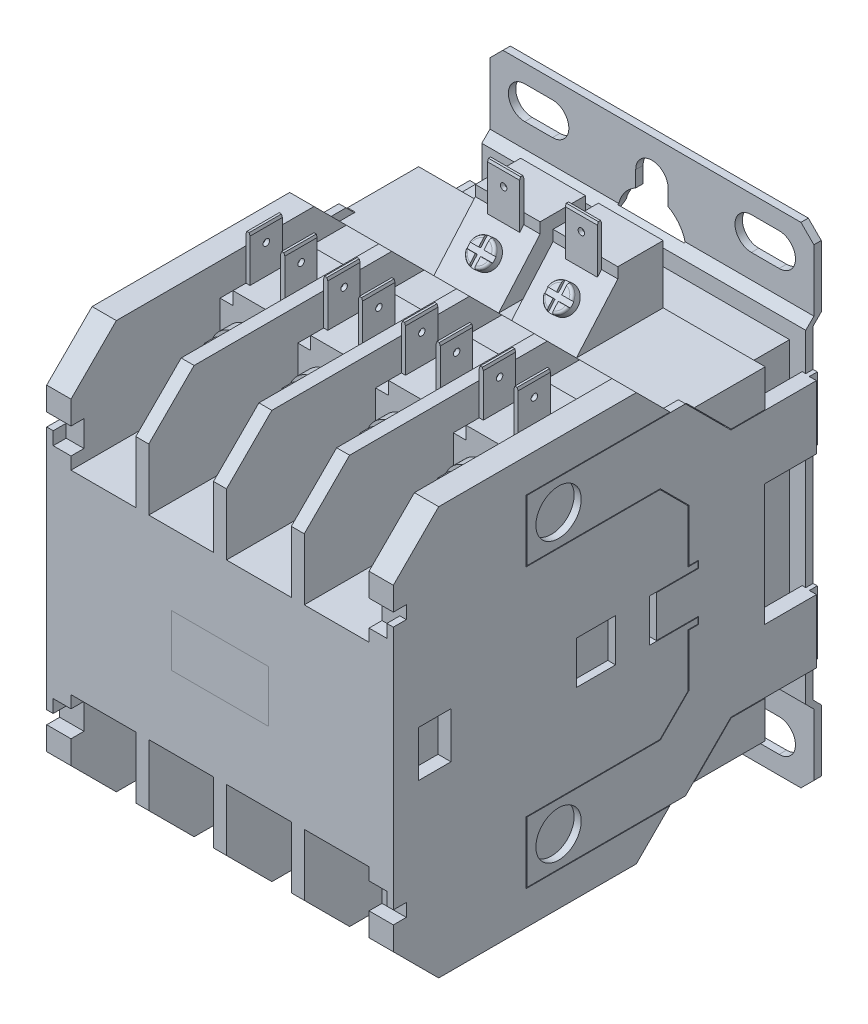
from build123d import *
from OCP.BRepFilletAPI import BRepFilletAPI_MakeChamfer

# Parameters (mm, degrees)
BOSS_EXTRUDE1_DEPTH      = 33.9725
BOSS_EXTRUDE1_DEPTH_BACK = 33.9725
BOSS_EXTRUDE2_DEPTH      = 31.75
BOSS_EXTRUDE2_DEPTH_BACK = 31.75
CUT_EXTRUDE1_DEPTH       = 105.273438748
CHAMFER1_SIZE            = 2.54
SKETCH7_W                = 12.7
SKETCH7_H                = 20.955
CUT_EXTRUDE2_DEPTH       = 31.75
SKETCH8_W                = 12.7
SKETCH8_H                = 6.35
CUT_EXTRUDE3_DEPTH       = 105.273438748
CUT_EXTRUDE5_DEPTH       = 103.95599558
BOSS_EXTRUDE3_START      = 4.191
BOSS_EXTRUDE3_DEPTH      = 2.54
SKETCH14_W               = 7.62
SKETCH14_H               = 2.54
BOSS_EXTRUDE4_DEPTH      = 12.7
SKETCH15_W               = 0.8
SKETCH15_H               = 6.35
BOSS_EXTRUDE5_DEPTH      = 8.89
SKETCH16_R               = 5.715
BOSS_EXTRUDE6_DEPTH      = 2.54
BOSS_EXTRUDE7_DEPTH      = 2.54
SKETCH30_R               = 0.635
CUT_EXTRUDE11_DEPTH      = 93.187938838
SKETCH18_OUTSIDE_W       = 398.532
SKETCH18_OUTSIDE_H       = 426.598
SKETCH18_OUTSIDE_R       = 4.7625
CUT_EXTRUDE6_DEPTH       = 86.43846539
CUT_EXTRUDE6_DRAFT       = -60
SKETCH19_W               = 1.016
SKETCH19_H               = 5.715
SKETCH19_W_2             = 9.525
SKETCH19_H_2             = 1.016
CUT_EXTRUDE_THIN1_DEPTH  = 1.27
CHAMFER2_SIZE            = 0.508
CHAMFER2_SIZE2           = 0.184896879
LPATTERN1_COUNT          = 2
LPATTERN1_PITCH          = 15.24
CUT_EXTRUDE7_DEPTH       = 2.54
SKETCH21_W               = 10.16
SKETCH21_H               = 57.15
CUT_EXTRUDE8_DEPTH       = 5.3975
CUT_EXTRUDE9_DEPTH       = 1.524
BOSS_EXTRUDE8_DEPTH      = 1.397
SKETCH24_W               = 11.4808
SKETCH24_H               = 12.446
BOSS_EXTRUDE9_DEPTH      = 1.524
SKETCH25_R               = 4.445
CUT_EXTRUDE10_DEPTH      = 97.087733359
BOSS_EXTRUDE10_START     = 1.27
BOSS_EXTRUDE10_DEPTH     = 12.7
BOSS_EXTRUDE11_START     = -1.27
BOSS_EXTRUDE11_DEPTH     = 12.7
SKETCH27_R               = 2.54
BOSS_EXTRUDE12_DEPTH     = 1.905
FILLET2_R                = 0.508
SKETCH28_W               = 6.3
SKETCH28_H               = 0.8
BOSS_EXTRUDE13_DEPTH     = 17.78
CHAMFER3_SIZE            = 0.508
CHAMFER3_SIZE2           = 0.184896879
SKETCH29_W               = 1.016
SKETCH29_H               = 5.08
SKETCH29_W_2             = 5.08
SKETCH29_H_2             = 1.016
CUT_EXTRUDE_THIN2_DEPTH  = 0.508
SKETCH31_R               = 0.635
CUT_EXTRUDE12_DEPTH      = 88.192906364
SKETCH32_W               = 15.494
SKETCH32_H               = 8.382
CUT_EXTRUDE13_DEPTH      = 1.524
SKETCH33_W               = 6.604
SKETCH33_H               = 8.382
BOSS_EXTRUDE14_DEPTH     = 1.524
SKETCH34_W               = 6.35
SKETCH34_H               = 9.017
CUT_EXTRUDE14_DEPTH      = 2.54


with BuildPart() as part:
    # Sketch4 → Boss-Extrude1 (new, two sides: drawn at the far end of the back side and taken through both)
    with BuildSketch(Plane(origin=(0, 0, 0), x_dir=(0, 0, -1), z_dir=(1, 0, 0)).offset(-BOSS_EXTRUDE1_DEPTH_BACK)):
        Polygon((-35.941, -31.115), (-35.941, 31.115), (-27.051, 40.005), (11.684, 40.005), (19.939, 31.75), (36.957, 31.75), (36.957, 28.575), (47.117, 28.575), (47.117, -28.575), (36.957, -28.575), (36.957, -31.75), (19.939, -31.75), (11.684, -40.005), (-27.051, -40.005), align=None)
    extrude(amount=BOSS_EXTRUDE1_DEPTH + BOSS_EXTRUDE1_DEPTH_BACK)

    # Sketch7 → Cut-Extrude2 (cut)
    with BuildSketch(Plane.XY.offset(35.941)):
        with Locations((-7.62, 29.5275)):
            Rectangle(SKETCH7_W, SKETCH7_H)
        with Locations((-22.86, 29.5275)):
            Rectangle(SKETCH7_W, SKETCH7_H)
        with Locations((7.62, 29.5275)):
            Rectangle(SKETCH7_W, SKETCH7_H)
        with Locations((22.86, 29.5275)):
            Rectangle(SKETCH7_W, SKETCH7_H)
        with Locations((7.62, -29.5275)):
            Rectangle(SKETCH7_W, SKETCH7_H)
        with Locations((22.86, -29.5275)):
            Rectangle(SKETCH7_W, SKETCH7_H)
        with Locations((-7.62, -29.5275)):
            Rectangle(SKETCH7_W, SKETCH7_H)
        with Locations((-22.86, -29.5275)):
            Rectangle(SKETCH7_W, SKETCH7_H)
    extrude(amount=-CUT_EXTRUDE2_DEPTH, mode=Mode.SUBTRACT)

    # Sketch8 → Cut-Extrude3 (cut, through all)
    with BuildSketch(Plane.XY.offset(35.941)):
        with Locations((-22.86, 36.83)):
            Rectangle(SKETCH8_W, SKETCH8_H)
        with Locations((-7.62, 36.83)):
            Rectangle(SKETCH8_W, SKETCH8_H)
        with Locations((7.62, 36.83)):
            Rectangle(SKETCH8_W, SKETCH8_H)
        with Locations((22.86, 36.83)):
            Rectangle(SKETCH8_W, SKETCH8_H)
        with Locations((22.86, -36.83)):
            Rectangle(SKETCH8_W, SKETCH8_H)
        with Locations((7.62, -36.83)):
            Rectangle(SKETCH8_W, SKETCH8_H)
        with Locations((-7.62, -36.83)):
            Rectangle(SKETCH8_W, SKETCH8_H)
        with Locations((-22.86, -36.83)):
            Rectangle(SKETCH8_W, SKETCH8_H)
    extrude(amount=-CUT_EXTRUDE3_DEPTH, mode=Mode.SUBTRACT)

    # Sketch20 → Cut-Extrude7 (cut)
    with BuildSketch(Plane.XY.offset(35.941)):
        Polygon((-29.21, 21.463), (-32.7025, 21.463), (-32.7025, 24.003), (-33.9725, 24.003), (-33.9725, 26.543), (-29.21, 26.543), align=None)
        Polygon((29.21, 26.543), (29.21, 21.463), (32.7025, 21.463), (32.7025, 24.003), (33.9725, 24.003), (33.9725, 26.543), align=None)
        Polygon((-29.21, -26.543), (-29.21, -21.463), (-32.7025, -21.463), (-32.7025, -24.003), (-33.9725, -24.003), (-33.9725, -26.543), align=None)
        Polygon((29.21, -21.463), (32.7025, -21.463), (32.7025, -24.003), (33.9725, -24.003), (33.9725, -26.543), (29.21, -26.543), align=None)
    extrude(amount=-CUT_EXTRUDE7_DEPTH, mode=Mode.SUBTRACT)

    # Sketch21 → Cut-Extrude8 (cut)
    with BuildSketch(Plane(origin=(33.9725, 0, 0), x_dir=(0, 0, -1), z_dir=(1, 0, 0))):
        with Locations((42.037, 0)):
            Rectangle(SKETCH21_W, SKETCH21_H)
    cut_extrude8 = extrude(amount=-CUT_EXTRUDE8_DEPTH, mode=Mode.SUBTRACT)

    # Mirror3: Cut-Extrude8 across plane
    add(cut_extrude8.mirror(Plane(origin=(0, 0, 0), x_dir=(0, 0, 1), z_dir=(1, 0, 0))), mode=Mode.SUBTRACT)

    # Sketch22 → Cut-Extrude9 (cut)
    with BuildSketch(Plane(origin=(33.9725, 0, 0), x_dir=(0, 0, -1), z_dir=(1, 0, 0))):
        Polygon((15.494, 4.191), (15.494, -4.191), (23.749, -4.191), (23.749, -5.334), (21.844, -5.334), (21.844, -15.69559278), (16.33059278, -21.209), (-9.906, -21.209), (-9.906, -33.401), (21.380684533, -33.401), (30.270684533, -24.511), (47.117, -24.511), (47.117, -11.811), (36.957, -11.811), (36.957, 11.811), (47.117, 11.811), (47.117, 24.511), (30.270684533, 24.511), (21.380684533, 33.401), (-9.906, 33.401), (-9.906, 21.209), (16.33059278, 21.209), (21.844, 15.69559278), (21.844, 5.334), (23.749, 5.334), (23.749, 4.191), align=None)
    cut_extrude9 = extrude(amount=-CUT_EXTRUDE9_DEPTH, mode=Mode.SUBTRACT)

    # Mirror4: Cut-Extrude9 across plane
    add(cut_extrude9.mirror(Plane(origin=(0, 0, 0), x_dir=(0, 0, 1), z_dir=(1, 0, 0))), mode=Mode.SUBTRACT)

    # Sketch26 → Boss-Extrude10 (add)
    with BuildSketch(Plane(origin=(0, 0, 0), x_dir=(0, 0, -1), z_dir=(1, 0, 0)).offset(BOSS_EXTRUDE10_START)):
        Polygon((19.939, 31.75), (36.957, 31.75), (36.957, 43.18), (28.067, 43.18), (28.067, 41.100194414), align=None)
    extrude(amount=BOSS_EXTRUDE10_DEPTH)

    # Sketch26<2> → Boss-Extrude11 (add)
    with BuildSketch(Plane(origin=(0, 0, 0), x_dir=(0, 0, -1), z_dir=(1, 0, 0)).offset(BOSS_EXTRUDE11_START)):
        Polygon((19.939, 31.75), (36.957, 31.75), (36.957, 43.18), (28.067, 43.18), (28.067, 41.100194414), align=None)
    extrude(amount=-BOSS_EXTRUDE11_DEPTH)

    # Sketch32 → Cut-Extrude13 (cut)
    with BuildSketch(Plane(origin=(33.9725, 0, 0), x_dir=(0, 0, -1), z_dir=(1, 0, 0))):
        with Locations((7.747, 0)):
            Rectangle(SKETCH32_W, SKETCH32_H)
    cut_extrude13 = extrude(amount=-CUT_EXTRUDE13_DEPTH, mode=Mode.SUBTRACT)

    # Sketch33 → Boss-Extrude14 (add)
    with BuildSketch(Plane(origin=(32.4485, 0, 0), x_dir=(0, 0, -1), z_dir=(1, 0, 0))):
        with Locations((10.922, 0)):
            Rectangle(SKETCH33_W, SKETCH33_H)
    boss_extrude14 = extrude(amount=BOSS_EXTRUDE14_DEPTH)

    # Sketch34 → Cut-Extrude14 (cut)
    with BuildSketch(Plane(origin=(33.9725, 0, 0), x_dir=(0, 0, -1), z_dir=(1, 0, 0))):
        with Locations((-27.813, 0)):
            Rectangle(SKETCH34_W, SKETCH34_H)
    cut_extrude14 = extrude(amount=-CUT_EXTRUDE14_DEPTH, mode=Mode.SUBTRACT)

    # Mirror11: Cut-Extrude13, Boss-Extrude14, Cut-Extrude14 across plane
    add(cut_extrude13.mirror(Plane(origin=(0, 0, 0), x_dir=(0, 0, 1), z_dir=(1, 0, 0))), mode=Mode.SUBTRACT)
    add(boss_extrude14.mirror(Plane(origin=(0, 0, 0), x_dir=(0, 0, 1), z_dir=(1, 0, 0))))
    add(cut_extrude14.mirror(Plane(origin=(0, 0, 0), x_dir=(0, 0, 1), z_dir=(1, 0, 0))), mode=Mode.SUBTRACT)


with BuildPart() as body_2:
    # Sketch5 → Boss-Extrude2 (new, two sides: drawn at the far end of the back side and taken through both)
    with BuildSketch(Plane(origin=(0, 0, 0), x_dir=(0, 0, -1), z_dir=(1, 0, 0)).offset(-BOSS_EXTRUDE2_DEPTH_BACK)):
        Polygon((48.5648, -31.749594041), (48.5648, 31.749594041), (50.165, 33.349794041), (50.165, 48.006), (48.7172, 48.006), (48.7172, 33.349794041), (47.117, 31.749594041), (47.117, -31.749594041), (48.7172, -33.349794041), (48.7172, -48.006), (50.165, -48.006), (50.165, -33.349794041), align=None)
    extrude(amount=BOSS_EXTRUDE2_DEPTH + BOSS_EXTRUDE2_DEPTH_BACK)

    # Sketch6 → Cut-Extrude1 (cut, through all)
    with BuildSketch(Plane(origin=(0, 0, -50.165), x_dir=(-1, 0, 0), z_dir=(0, 0, -1))):
        with BuildLine():
            Line((-24.931440805, 38.0390146), (-19.490995499, 38.0390146))
            ThreePointArc((-19.490995499, 38.0390146), (-16.285490099, 41.24452), (-19.490995499, 44.4500254))
            Line((-19.490995499, 44.4500254), (-24.931440805, 44.4500254))
            ThreePointArc((-24.931440805, 44.4500254), (-28.136946205, 41.24452), (-24.931440805, 38.0390146))
        make_face()
        with BuildLine():
            Line((19.490995499, 44.4500254), (24.931440805, 44.4500254))
            ThreePointArc((24.931440805, 44.4500254), (28.136946205, 41.24452), (24.931440805, 38.0390146))
            Line((24.931440805, 38.0390146), (19.490995499, 38.0390146))
            ThreePointArc((19.490995499, 38.0390146), (16.285490099, 41.24452), (19.490995499, 44.4500254))
        make_face()
        with BuildLine():
            Line((24.931440805, -38.0390146), (19.490995499, -38.0390146))
            ThreePointArc((19.490995499, -38.0390146), (16.285490099, -41.24452), (19.490995499, -44.4500254))
            Line((19.490995499, -44.4500254), (24.931440805, -44.4500254))
            ThreePointArc((24.931440805, -44.4500254), (28.136946205, -41.24452), (24.931440805, -38.0390146))
        make_face()
        with BuildLine():
            Line((-19.490995499, -44.4500254), (-24.931440805, -44.4500254))
            ThreePointArc((-24.931440805, -44.4500254), (-28.136946205, -41.24452), (-24.931440805, -38.0390146))
            Line((-24.931440805, -38.0390146), (-19.490995499, -38.0390146))
            ThreePointArc((-19.490995499, -38.0390146), (-16.285490099, -41.24452), (-19.490995499, -44.4500254))
        make_face()
    extrude(amount=-CUT_EXTRUDE1_DEPTH, mode=Mode.SUBTRACT)

    # Chamfer1
    chamfer1_edges = [body_2.edges().sort_by_distance(p)[0] for p in [
        (31.75, 48.006, -49.4411),
        (31.75, -48.006, -49.4411),
        (-31.75, -48.006, -49.4411),
        (-31.75, 48.006, -49.4411),
    ]]
    chamfer(chamfer1_edges, length=CHAMFER1_SIZE)

    # Sketch10 → Cut-Extrude5 (cut, through all)
    with BuildSketch(Plane(origin=(0, 0, -48.5648), x_dir=(-1, 0, 0), z_dir=(0, 0, -1))):
        with BuildLine():
            Line((-7.62, -48.006), (-11.43, -48.006))
            Line((-11.43, -48.006), (-11.43, -35.4838))
            ThreePointArc((-11.43, -35.4838), (-9.525, -33.5788), (-7.62, -35.4838))
            Line((-7.62, -35.4838), (-7.62, -48.006))
        make_face()
        with BuildLine():
            Line((-3.81, -48.006), (3.81, -48.006))
            Line((3.81, -48.006), (3.81, -37.3888))
            ThreePointArc((3.81, -37.3888), (0, -33.5788), (-3.81, -37.3888))
            Line((-3.81, -37.3888), (-3.81, -48.006))
        make_face()
        with BuildLine():
            Line((7.62, -48.006), (11.43, -48.006))
            Line((11.43, -48.006), (11.43, -35.4838))
            ThreePointArc((11.43, -35.4838), (9.525, -33.5788), (7.62, -35.4838))
            Line((7.62, -35.4838), (7.62, -48.006))
        make_face()
        with BuildLine():
            Line((-6.697512638, 31.749594041), (6.697512638, 31.749594041))
            ThreePointArc((6.697512638, 31.749594041), (5.749838178, 35.184129884), (3.175, 37.646716266))
            Line((3.175, 37.646716266), (3.175, 40.767))
            ThreePointArc((3.175, 40.767), (0, 43.942), (-3.175, 40.767))
            Line((-3.175, 40.767), (-3.175, 37.646716266))
            ThreePointArc((-3.175, 37.646716266), (-5.749838178, 35.184129884), (-6.697512638, 31.749594041))
        make_face()
    extrude(amount=CUT_EXTRUDE5_DEPTH, mode=Mode.SUBTRACT)


with BuildPart() as body_3:
    # Sketch12 → Boss-Extrude3 (new body)
    with BuildSketch(Plane.XY.offset(BOSS_EXTRUDE3_START)):
        Polygon((-16.51, 19.05), (-16.51, 33.655), (-19.05, 33.655), (-19.05, 36.195), (-26.67, 36.195), (-26.67, 33.655), (-29.21, 33.655), (-29.21, 19.05), align=None)
    extrude(amount=BOSS_EXTRUDE3_DEPTH)

    # Sketch14 → Boss-Extrude4 (add)
    with BuildSketch(Plane(origin=(0, 0, 4.191), x_dir=(-1, 0, 0), z_dir=(0, 0, -1))):
        with Locations((22.86, 34.925)):
            Rectangle(SKETCH14_W, SKETCH14_H)
    extrude(amount=BOSS_EXTRUDE4_DEPTH)

    # Sketch15 → Boss-Extrude5 (add)
    with BuildSketch(Plane(origin=(0, 36.195, 0), x_dir=(1, 0, 0), z_dir=(0, 1, 0))):
        with Locations((-26.27, -1.016)):
            Rectangle(SKETCH15_W, SKETCH15_H)
        with Locations((-19.45, -1.016)):
            Rectangle(SKETCH15_W, SKETCH15_H)
    extrude(amount=BOSS_EXTRUDE5_DEPTH)

    # Sketch30 → Cut-Extrude11 (cut, through all)
    with BuildSketch(Plane.ZY.offset(26.67)):
        with Locations((0.991, 41.91)):
            Circle(SKETCH30_R)
    extrude(amount=-CUT_EXTRUDE11_DEPTH, mode=Mode.SUBTRACT)

    # Chamfer2: one chamfer whose edges measure the first distance from different faces: ONE call of the kernel's chamfer builder (chamfer() names one face for all edges)
    chamfer2_edges_1 = [body_3.edges().sort_by_distance(p)[0] for p in [
        (-19.05, 45.085, 1.016),
    ]]
    chamfer2_side_1 = [body_3.faces().sort_by_distance(p)[0] for p in [
        (-19.05, 38.26675598, 0.230967317),
    ]]
    chamfer2_edges_2 = [body_3.edges().sort_by_distance(p)[0] for p in [
        (-19.85, 45.085, 1.016),
    ]]
    chamfer2_side_2 = [body_3.faces().sort_by_distance(p)[0] for p in [
        (-19.85, 40.610847077, 1.016573876),
    ]]
    chamfer2_edges_3 = [body_3.edges().sort_by_distance(p)[0] for p in [
        (-25.87, 45.085, 1.016),
    ]]
    chamfer2_side_3 = [body_3.faces().sort_by_distance(p)[0] for p in [
        (-25.87, 40.610847077, 1.016573876),
    ]]
    chamfer2_edges_4 = [body_3.edges().sort_by_distance(p)[0] for p in [
        (-26.67, 45.085, 1.016),
    ]]
    chamfer2_side_4 = [body_3.faces().sort_by_distance(p)[0] for p in [
        (-26.67, 38.26675598, 0.230967317),
    ]]
    chamfer2 = BRepFilletAPI_MakeChamfer(body_3.part.solid().wrapped)
    for e in chamfer2_edges_1:
        chamfer2.Add(CHAMFER2_SIZE, CHAMFER2_SIZE2, e.wrapped, chamfer2_side_1[0].wrapped)  # the first distance lies on this face
    for e in chamfer2_edges_2:
        chamfer2.Add(CHAMFER2_SIZE, CHAMFER2_SIZE2, e.wrapped, chamfer2_side_2[0].wrapped)  # the first distance lies on this face
    for e in chamfer2_edges_3:
        chamfer2.Add(CHAMFER2_SIZE, CHAMFER2_SIZE2, e.wrapped, chamfer2_side_3[0].wrapped)  # the first distance lies on this face
    for e in chamfer2_edges_4:
        chamfer2.Add(CHAMFER2_SIZE, CHAMFER2_SIZE2, e.wrapped, chamfer2_side_4[0].wrapped)  # the first distance lies on this face
    add(Compound.cast(chamfer2.Shape()), mode=Mode.REPLACE)


with BuildPart() as body_4:
    # Sketch16 → Boss-Extrude6 (new body)
    with BuildSketch(Plane.XY.offset(6.731)):
        with Locations((-22.86, 26.3525)):
            Circle(SKETCH16_R)
    extrude(amount=BOSS_EXTRUDE6_DEPTH)

    # Sketch17 → Boss-Extrude7 (add)
    with BuildSketch(Plane.XY.offset(9.271)):
        Polygon((-22.86, 31.851761314), (-27.6225, 29.102130657), (-27.6225, 23.602869343), (-22.86, 20.853238686), (-18.0975, 23.602869343), (-18.0975, 29.102130657), align=None)
    extrude(amount=BOSS_EXTRUDE7_DEPTH)


with BuildPart() as cut_extrude6_tool:
    # Sketch18 outside → Cut-Extrude6 (with draft: the straight prism first)
    with BuildSketch(Plane.XY.offset(11.811)):
        Rectangle(SKETCH18_OUTSIDE_W, SKETCH18_OUTSIDE_H)
        with Locations((-22.86, 26.3525)):
            Circle(SKETCH18_OUTSIDE_R, mode=Mode.SUBTRACT)
    extrude(amount=-CUT_EXTRUDE6_DEPTH)
    # Cut-Extrude6: the draft: its side faces are tilted about the plane it starts from
    cut_extrude6_sides = [cut_extrude6_tool.faces().sort_by_distance(p)[0] for p in [
        (0, -213.299, -31.408232695),
        (199.266, 0, -31.408232695),
        (0, 213.299, -31.408232695),
        (-199.266, 0, -31.408232695),
        (-27.6225, 26.3525, -31.408232695),
    ]]
    draft(cut_extrude6_sides, Plane.XY.offset(11.811), CUT_EXTRUDE6_DRAFT)


with BuildPart() as body_4_1:
    add(body_4.part)

    # Cut-Extrude6: cut by cut_extrude6_tool
    add(cut_extrude6_tool.part, mode=Mode.SUBTRACT)

    # Sketch19 → Cut-Extrude-Thin1 (cut)
    with BuildSketch(Plane.XY.offset(11.811)):
        with Locations((-22.86, 26.3525)):
            Rectangle(SKETCH19_W, SKETCH19_H)
        with Locations((-22.86, 26.3525)):
            Rectangle(SKETCH19_W_2, SKETCH19_H_2)
    extrude(amount=-CUT_EXTRUDE_THIN1_DEPTH, mode=Mode.SUBTRACT)


with BuildPart() as lpattern1_1:
    # LPattern1: pattern copy
    add(body_4_1.part.moved(Location(Vector(1, 0, 0) * (1 * LPATTERN1_PITCH))))


with BuildPart() as lpattern1_2:
    # LPattern1: pattern copy
    add(body_3.part.moved(Location(Vector(1, 0, 0) * (1 * LPATTERN1_PITCH))))


with BuildPart() as body_7:
    # Mirror1: mirrored copy
    add(body_3.part.mirror(Plane(origin=(0, 0, 0), x_dir=(0, 0, 1), z_dir=(1, 0, 0))))


with BuildPart() as body_8:
    # Mirror1 2: mirrored copy
    add(lpattern1_1.part.mirror(Plane(origin=(0, 0, 0), x_dir=(0, 0, 1), z_dir=(1, 0, 0))))


with BuildPart() as body_9:
    # Mirror1 3: mirrored copy
    add(lpattern1_2.part.mirror(Plane(origin=(0, 0, 0), x_dir=(0, 0, 1), z_dir=(1, 0, 0))))


with BuildPart() as body_10:
    # Mirror1 4: mirrored copy
    add(body_4_1.part.mirror(Plane(origin=(0, 0, 0), x_dir=(0, 0, 1), z_dir=(1, 0, 0))))


with BuildPart() as body_11:
    # Mirror2: mirrored copy
    add(body_4_1.part.mirror(Plane.ZX))


with BuildPart() as body_12:
    # Mirror2 2: mirrored copy
    add(body_3.part.mirror(Plane.ZX))


with BuildPart() as body_13:
    # Mirror2 3: mirrored copy
    add(lpattern1_1.part.mirror(Plane.ZX))


with BuildPart() as body_14:
    # Mirror2 4: mirrored copy
    add(lpattern1_2.part.mirror(Plane.ZX))


with BuildPart() as body_15:
    # Mirror2 5: mirrored copy
    add(body_7.part.mirror(Plane.ZX))


with BuildPart() as body_16:
    # Mirror2 6: mirrored copy
    add(body_8.part.mirror(Plane.ZX))


with BuildPart() as body_17:
    # Mirror2 7: mirrored copy
    add(body_9.part.mirror(Plane.ZX))


with BuildPart() as body_18:
    # Mirror2 8: mirrored copy
    add(body_10.part.mirror(Plane.ZX))


with BuildPart() as body_19:
    # Sketch23 → Boss-Extrude8 (new body)
    with BuildSketch(Plane(origin=(33.9725, 0, 0), x_dir=(0, 0, -1), z_dir=(1, 0, 0))):
        Polygon((36.83, -11.938), (36.83, 11.938), (46.99, 11.938), (46.99, 24.384), (30.21807941, 24.384), (21.32807941, 33.274), (-9.779, 33.274), (-9.779, 21.336), (16.383197903, 21.336), (21.971, 15.748197903), (21.971, 5.461), (23.876, 5.461), (23.876, 4.064), (15.621, 4.064), (15.621, -4.064), (23.876, -4.064), (23.876, -5.461), (21.971, -5.461), (21.971, -15.748197903), (16.383197903, -21.336), (-9.779, -21.336), (-9.779, -33.274), (21.32807941, -33.274), (30.21807941, -24.384), (46.99, -24.384), (46.99, -11.938), align=None)
    extrude(amount=-BOSS_EXTRUDE8_DEPTH)

    # Sketch24 → Boss-Extrude9 (add)
    with BuildSketch(Plane.ZY.offset(-32.5755)):
        with Locations((-42.8244, 18.161)):
            Rectangle(SKETCH24_W, SKETCH24_H)
    boss_extrude9 = extrude(amount=BOSS_EXTRUDE9_DEPTH)

    # Mirror7: Boss-Extrude9 across plane
    add(boss_extrude9.mirror(Plane.ZX))

    # Sketch25 → Cut-Extrude10 (cut, through all)
    with BuildSketch(Plane(origin=(32.4485, 0, 0), x_dir=(0, 0, -1), z_dir=(1, 0, 0))):
        with Locations(Location((-3.556, 27.305, 0), (0, 0, 180))):
            Circle(SKETCH25_R)
        with Locations(Location((-3.556, -27.305, 0), (0, 0, 180))):
            Circle(SKETCH25_R)
    extrude(amount=CUT_EXTRUDE10_DEPTH, mode=Mode.SUBTRACT)


with BuildPart() as body_20:
    # Mirror9: mirrored copy
    add(body_19.part.mirror(Plane(origin=(0, 0, 0), x_dir=(0, 0, 1), z_dir=(1, 0, 0))))


with BuildPart() as body_2_1:
    add(body_2.part)

    # Combine1: read off the stored shape, not the designer's step
    # Combine1: union body 19, body 20
    add(body_19.part)
    add(body_20.part)


with BuildPart() as body_19_2:
    # Sketch27 → Boss-Extrude12 (new body)
    with BuildSketch(Plane(origin=(0, 3.793149511, 4.363519361), x_dir=(1, 0, 0), z_dir=(0, 0.6560590289905134, 0.7547095802227667))):
        with Locations(Location((7.62, 43.237754695, 0), (0, 0, 270))):
            Circle(SKETCH27_R)
    extrude(amount=BOSS_EXTRUDE12_DEPTH)

    # Fillet2
    fillet2_edges = [body_19_2.edges().sort_by_distance(p)[0] for p in [
        (7.62, 39.591851991, -24.231668183),
    ]]
    fillet(fillet2_edges, radius=FILLET2_R)

    # Sketch29 → Cut-Extrude-Thin2 (cut)
    with BuildSketch(Plane(origin=(0, 5.042941961, 5.801241112), x_dir=(1, 0, 0), z_dir=(0, 0.6560590289905134, 0.7547095802227667))):
        with Locations((7.62, 43.237754695)):
            Rectangle(SKETCH29_W, SKETCH29_H)
        with Locations((7.62, 43.237754695)):
            Rectangle(SKETCH29_W_2, SKETCH29_H_2)
    extrude(amount=-CUT_EXTRUDE_THIN2_DEPTH, mode=Mode.SUBTRACT)


with BuildPart() as body_20_2:
    # Sketch28 → Boss-Extrude13 (new body)
    with BuildSketch(Plane(origin=(0, 31.75, 0), x_dir=(1, 0, 0), z_dir=(0, 1, 0))):
        with Locations((7.62, 27.667)):
            Rectangle(SKETCH28_W, SKETCH28_H)
    extrude(amount=BOSS_EXTRUDE13_DEPTH)

    # Chamfer3: one chamfer whose edges measure the first distance from different faces: ONE call of the kernel's chamfer builder (chamfer() names one face for all edges)
    chamfer3_edges_1 = [body_20_2.edges().sort_by_distance(p)[0] for p in [
        (7.62, 49.53, -28.067),
    ]]
    chamfer3_side_1 = [body_20_2.faces().sort_by_distance(p)[0] for p in [
        (7.62, 40.64, -28.067),
    ]]
    chamfer3_edges_2 = [body_20_2.edges().sort_by_distance(p)[0] for p in [
        (7.62, 49.53, -27.267),
    ]]
    chamfer3_side_2 = [body_20_2.faces().sort_by_distance(p)[0] for p in [
        (7.62, 40.64, -27.267),
    ]]
    chamfer3 = BRepFilletAPI_MakeChamfer(body_20_2.part.solid().wrapped)
    for e in chamfer3_edges_1:
        chamfer3.Add(CHAMFER3_SIZE, CHAMFER3_SIZE2, e.wrapped, chamfer3_side_1[0].wrapped)  # the first distance lies on this face
    for e in chamfer3_edges_2:
        chamfer3.Add(CHAMFER3_SIZE, CHAMFER3_SIZE2, e.wrapped, chamfer3_side_2[0].wrapped)  # the first distance lies on this face
    add(Compound.cast(chamfer3.Shape()), mode=Mode.REPLACE)

    # Sketch31 → Cut-Extrude12 (cut, through all)
    with BuildSketch(Plane.XY.offset(-27.267)):
        with Locations((7.6196, 46.355)):
            Circle(SKETCH31_R)
    extrude(amount=-CUT_EXTRUDE12_DEPTH, mode=Mode.SUBTRACT)


with BuildPart() as body_21:
    # Mirror10: mirrored copy
    add(body_19_2.part.mirror(Plane(origin=(0, 0, 0), x_dir=(0, 0, 1), z_dir=(1, 0, 0))))


with BuildPart() as body_22:
    # Mirror10 2: mirrored copy
    add(body_20_2.part.mirror(Plane(origin=(0, 0, 0), x_dir=(0, 0, 1), z_dir=(1, 0, 0))))


solid = Compound([part.part, body_3.part, body_4_1.part, lpattern1_1.part, lpattern1_2.part, body_7.part, body_8.part, body_9.part, body_10.part, body_11.part, body_12.part, body_13.part, body_14.part, body_15.part, body_16.part, body_17.part, body_18.part, body_2_1.part, body_19_2.part, body_20_2.part, body_21.part, body_22.part])
